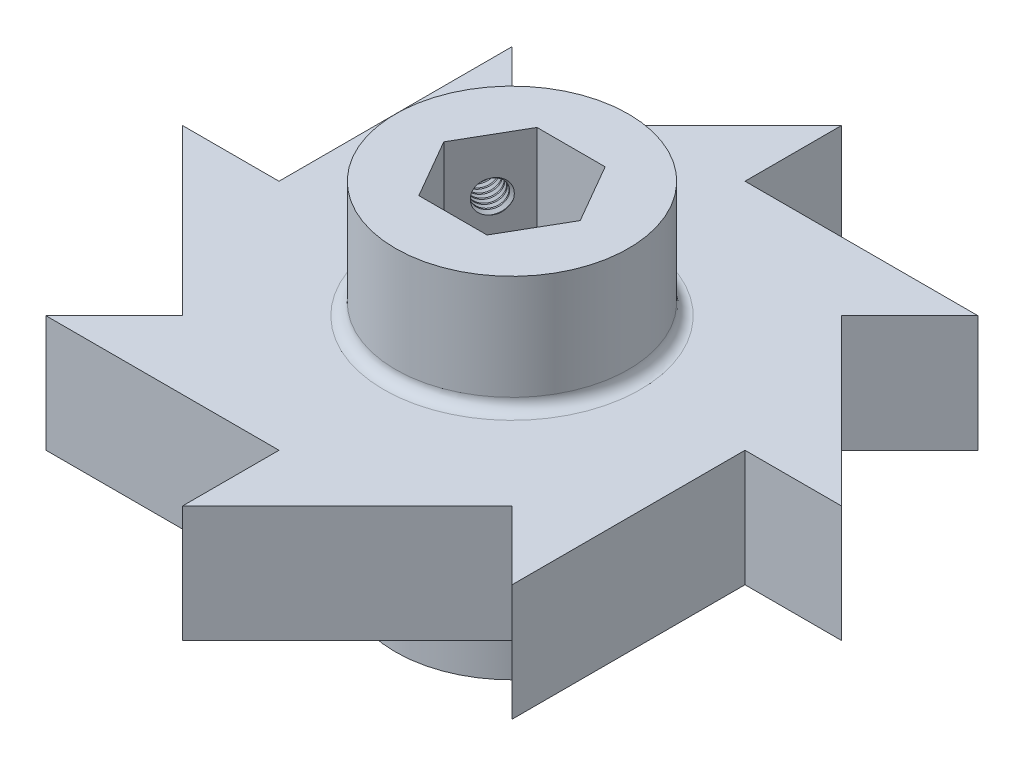
from build123d import *

# Parameters (mm, degrees)
BOSS_EXTRUDE1_DEPTH      = 12.7
BOSS_EXTRUDE2_DEPTH      = 12.7
BOSS_EXTRUDE2_DEPTH_BACK = 25.4
SKETCH2_R                = 12.7
FILLET1_R                = 1.27
CUT_EXTRUDE1_DEPTH       = 38.1
SKETCH4_R                = 1.5875
CUT_EXTRUDE2_DEPTH       = 12.7
THREAD2_PITCH            = 0.7
THREAD3_PITCH            = 0.7


with BuildPart() as part:
    # Sketch1 → Boss-Extrude1 (new body)
    with BuildSketch(Plane(origin=(0, 0, 0), x_dir=(1, 0, 0), z_dir=(0, 1, 0))):
        Polygon((-10.521024484, 25.4), (-17.960512242, 17.960512242), (-25.4, 25.4), (-25.4, 10.521024484), (-25.4, 0), (-35.921024484, 0), (-25.4, -10.521024484), (-17.960512242, -17.960512242), (-25.4, -25.4), (-10.521024484, -25.4), (0, -25.4), (0, -35.921024484), (10.521024484, -25.4), (17.960512242, -17.960512242), (25.4, -25.4), (25.4, -10.521024484), (25.4, 0), (35.921024484, 0), (25.4, 10.521024484), (17.960512242, 17.960512242), (25.4, 25.4), (10.521024484, 25.4), (0, 25.4), (0, 35.921024484), align=None)
    extrude(amount=BOSS_EXTRUDE1_DEPTH)

    # Sketch2 → Boss-Extrude2 (add, two sides: drawn at the far end of the back side and taken through both)
    with BuildSketch(Plane(origin=(0, 12.7, 0), x_dir=(1, 0, 0), z_dir=(0, 1, 0)).offset(-BOSS_EXTRUDE2_DEPTH_BACK)):
        with Locations(Location((0, 0, 0), (0, 0, 270))):
            Circle(SKETCH2_R)
    extrude(amount=BOSS_EXTRUDE2_DEPTH + BOSS_EXTRUDE2_DEPTH_BACK)

    # Fillet1
    fillet1_edges = [part.edges().sort_by_distance(p)[0] for p in [
        (0, 12.7, -12.7),
        (0, 0, -12.7),
    ]]
    fillet(fillet1_edges, radius=FILLET1_R)

    # Sketch3 → Cut-Extrude1 (cut)
    with BuildSketch(Plane(origin=(0, 25.4, 0), x_dir=(1, 0, 0), z_dir=(0, 1, 0))):
        Polygon((-3.717500648, 6.4389), (-7.435001297, 0), (-3.717500648, -6.4389), (3.717500648, -6.4389), (7.435001297, 0), (3.717500648, 6.4389), align=None)
    extrude(amount=-CUT_EXTRUDE1_DEPTH, mode=Mode.SUBTRACT)

    # Sketch4 → Cut-Extrude2 (cut)
    with BuildSketch(Plane(origin=(-5.576250972, 0, -3.21945), x_dir=(0.4999999999999966, 0, -0.8660254037844406), z_dir=(0.8660254037844406, 0, 0.4999999999999966))):
        with Locations((0, 19.685)):
            Circle(SKETCH4_R)
        with Locations((0, -6.985)):
            Circle(SKETCH4_R)
    extrude(amount=-CUT_EXTRUDE2_DEPTH, mode=Mode.SUBTRACT)

    # Thread2: the profile of Thread Profile2 profile screwed along a right-hand helix of 14.285714 turns, 6 arcs to a turn; built about Z, then put on its axis
    thread2_z = Axis((0, 0, 0), (0, 0, 1))
    thread2_corners = [(1.5872, 0, -0.000173205), (1.966386113, 0, 0.218749999), (1.966386113, 0, 0.306249999), (1.5872, 0, 0.525173204)]
    with BuildLine(mode=Mode.PRIVATE) as thread2_profile:
        Line(thread2_corners[0], thread2_corners[1])
        Line(thread2_corners[1], thread2_corners[2])
        Line(thread2_corners[2], thread2_corners[3])
        Line(thread2_corners[3], thread2_corners[0])
    thread2_cap = Face(thread2_profile.wire())
    thread2_turn_angles = [0, 30, 60, 90, 120, 150, 180, 210, 240, 270, 300, 330, 360]
    thread2_turn_weights = [1, 0.8660254037844387, 1, 0.8660254037844387, 1, 0.8660254037844387, 1, 0.8660254037844387, 1, 0.8660254037844387, 1, 0.8660254037844387, 1]
    thread2_turn_rails = [Edge.make_bspline([Vector(p[0], p[1], 0).rotate(thread2_z, thread2_turn_angles[k]) / thread2_turn_weights[k] + Vector(0, 0, p[2] + THREAD2_PITCH * thread2_turn_angles[k] / 360) for k in range(13)], [0, 0, 0, 1, 1, 2, 2, 3, 3, 4, 4, 5, 5, 6, 6, 6], 2, thread2_turn_weights) for p in thread2_corners]
    thread2_turn_sides = [Face.make_surface_from_curves(thread2_turn_rails[p[0]], thread2_turn_rails[p[1]]) for p in [(0, 1), (1, 2), (2, 3), (3, 0)]]
    thread2_last_angles = [5040, 5070, 5100, 5121.428571429, 5142.857142857]
    thread2_last_weights = [1, 0.8660254037844387, 1, 0.9308737486442035, 1]
    thread2_last_rails = [Edge.make_bspline([Vector(p[0], p[1], 0).rotate(thread2_z, thread2_last_angles[k]) / thread2_last_weights[k] + Vector(0, 0, p[2] + THREAD2_PITCH * thread2_last_angles[k] / 360) for k in range(5)], [0, 0, 0, 1, 1, 2, 2, 2], 2, thread2_last_weights) for p in thread2_corners]
    thread2_last_sides = [Face.make_surface_from_curves(thread2_last_rails[p[0]], thread2_last_rails[p[1]]) for p in [(0, 1), (1, 2), (2, 3), (3, 0)]]
    thread2 = Plane(origin=(-3.156575994, 19.685, -1.82245), x_dir=(-0.5, 0, 0.866025404), z_dir=(-0.866025404, 0, -0.5)) * Solid(Shell([*[p.moved(Location((0, 0, THREAD2_PITCH * i))) for i in range(14) for p in thread2_turn_sides], *thread2_last_sides, thread2_cap, thread2_cap.rotate(thread2_z, 5142.857142857).moved(Location((0, 0, THREAD2_PITCH * 5142.857142857 / 360)))]))
    add(thread2, mode=Mode.SUBTRACT)

    # Thread3: the profile of Thread Profile4 profile screwed along a right-hand helix of 14.285714 turns, 6 arcs to a turn; built about Z, then put on its axis
    thread3_z = Axis((0, 0, 0), (0, 0, 1))
    thread3_corners = [(1.5872, 0, -0.000173205), (1.966386113, 0, 0.218749999), (1.966386113, 0, 0.306249999), (1.5872, 0, 0.525173204)]
    with BuildLine(mode=Mode.PRIVATE) as thread3_profile:
        Line(thread3_corners[0], thread3_corners[1])
        Line(thread3_corners[1], thread3_corners[2])
        Line(thread3_corners[2], thread3_corners[3])
        Line(thread3_corners[3], thread3_corners[0])
    thread3_cap = Face(thread3_profile.wire())
    thread3_turn_angles = [0, 30, 60, 90, 120, 150, 180, 210, 240, 270, 300, 330, 360]
    thread3_turn_weights = [1, 0.8660254037844387, 1, 0.8660254037844387, 1, 0.8660254037844387, 1, 0.8660254037844387, 1, 0.8660254037844387, 1, 0.8660254037844387, 1]
    thread3_turn_rails = [Edge.make_bspline([Vector(p[0], p[1], 0).rotate(thread3_z, thread3_turn_angles[k]) / thread3_turn_weights[k] + Vector(0, 0, p[2] + THREAD3_PITCH * thread3_turn_angles[k] / 360) for k in range(13)], [0, 0, 0, 1, 1, 2, 2, 3, 3, 4, 4, 5, 5, 6, 6, 6], 2, thread3_turn_weights) for p in thread3_corners]
    thread3_turn_sides = [Face.make_surface_from_curves(thread3_turn_rails[p[0]], thread3_turn_rails[p[1]]) for p in [(0, 1), (1, 2), (2, 3), (3, 0)]]
    thread3_last_angles = [5040, 5070, 5100, 5121.428571429, 5142.857142857]
    thread3_last_weights = [1, 0.8660254037844387, 1, 0.9308737486442035, 1]
    thread3_last_rails = [Edge.make_bspline([Vector(p[0], p[1], 0).rotate(thread3_z, thread3_last_angles[k]) / thread3_last_weights[k] + Vector(0, 0, p[2] + THREAD3_PITCH * thread3_last_angles[k] / 360) for k in range(5)], [0, 0, 0, 1, 1, 2, 2, 2], 2, thread3_last_weights) for p in thread3_corners]
    thread3_last_sides = [Face.make_surface_from_curves(thread3_last_rails[p[0]], thread3_last_rails[p[1]]) for p in [(0, 1), (1, 2), (2, 3), (3, 0)]]
    thread3 = Plane(origin=(-3.156575994, -6.985, -1.82245), x_dir=(-0.5, 0, 0.866025404), z_dir=(-0.866025404, 0, -0.5)) * Solid(Shell([*[p.moved(Location((0, 0, THREAD3_PITCH * i))) for i in range(14) for p in thread3_turn_sides], *thread3_last_sides, thread3_cap, thread3_cap.rotate(thread3_z, 5142.857142857).moved(Location((0, 0, THREAD3_PITCH * 5142.857142857 / 360)))]))
    add(thread3, mode=Mode.SUBTRACT)


solid = part.part
